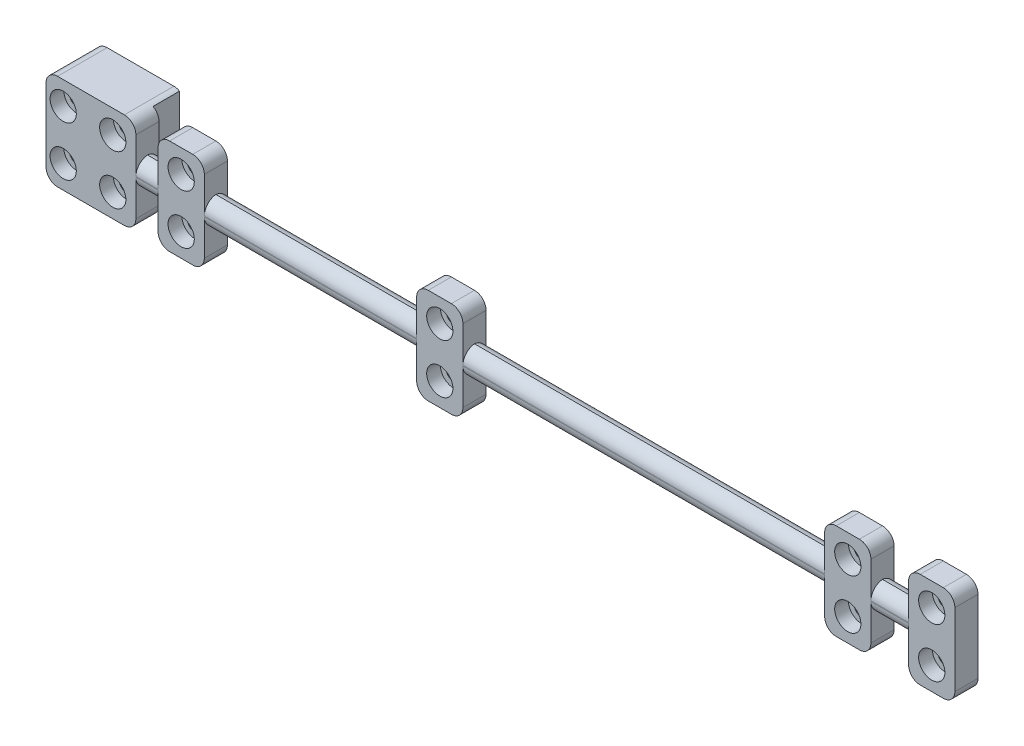
from build123d import *

# Parameters (mm, degrees)
SKETCH1_W                                      = 25.4
SKETCH1_H                                      = 29
BOSS_EXTRUDE1_DEPTH                            = 8
SKETCH2_W                                      = 275
SKETCH2_H                                      = 29
BOSS_EXTRUDE2_DEPTH                            = 7
CBORE_FOR_8_SOCKET_HEAD_CAP_SCREW1_D           = 4.4958
CBORE_FOR_8_SOCKET_HEAD_CAP_SCREW1_DEPTH       = 18.649325414
CBORE_FOR_8_SOCKET_HEAD_CAP_SCREW1_CBORE_D     = 7.9375
CBORE_FOR_8_SOCKET_HEAD_CAP_SCREW1_CBORE_DEPTH = 4.1656
CBORE_FOR_8_SOCKET_HEAD_CAP_SCREW1_TIP         = 1.350674586
SKETCH5_W                                      = 64.25
SKETCH5_H                                      = 10.5
SKETCH5_W_2                                    = 109.45
SKETCH5_W_3                                    = 11.4
SKETCH5_W_4                                    = 6.7
CUT_EXTRUDE1_DEPTH                             = 10
FILLET1_R                                      = 3.9
FILLET2_R                                      = 3.5


with BuildPart() as part:
    # Sketch1 → Boss-Extrude1 (new body)
    with BuildSketch(Plane.XY):
        Rectangle(SKETCH1_W, SKETCH1_H)
    extrude(amount=BOSS_EXTRUDE1_DEPTH)

    # Sketch2 → Boss-Extrude2 (add)
    with BuildSketch(Plane.XY.offset(8)):
        with Locations((124.8, 0)):
            Rectangle(SKETCH2_W, SKETCH2_H)
    extrude(amount=BOSS_EXTRUDE2_DEPTH)

    # CBORE for #8 Socket Head Cap Screw1
    with Locations(Plane(origin=(-7.5, 7.5, 15), x_dir=(1, 0, 0), z_dir=(0, 0, 1))):
        with Locations((0, 0), (15, 0), (15, -15), (0, -15), (35.7, 0), (35.7, -15), (113.95, 0), (113.95, -15), (237.4, 0), (237.4, -15), (262.8, 0), (262.8, -15)):
            CounterBoreHole(CBORE_FOR_8_SOCKET_HEAD_CAP_SCREW1_D / 2, CBORE_FOR_8_SOCKET_HEAD_CAP_SCREW1_CBORE_D / 2, CBORE_FOR_8_SOCKET_HEAD_CAP_SCREW1_CBORE_DEPTH, depth=CBORE_FOR_8_SOCKET_HEAD_CAP_SCREW1_DEPTH)
            with Locations((0, 0, -(CBORE_FOR_8_SOCKET_HEAD_CAP_SCREW1_DEPTH + CBORE_FOR_8_SOCKET_HEAD_CAP_SCREW1_TIP / 2))):  # 118° drill point
                Cone(0, CBORE_FOR_8_SOCKET_HEAD_CAP_SCREW1_D / 2, CBORE_FOR_8_SOCKET_HEAD_CAP_SCREW1_TIP, mode=Mode.SUBTRACT)

    # Sketch5 → Cut-Extrude1 (cut)
    with BuildSketch(Plane.XY.offset(15)):
        with Locations((67.325, 9.25)):
            Rectangle(SKETCH5_W, SKETCH5_H)
        with Locations((168.175, 9.25)):
            Rectangle(SKETCH5_W_2, SKETCH5_H)
        with Locations((242.6, 9.25)):
            Rectangle(SKETCH5_W_3, SKETCH5_H)
        with Locations((17.85, 9.25)):
            Rectangle(SKETCH5_W_4, SKETCH5_H)
    cut_extrude1 = extrude(amount=-CUT_EXTRUDE1_DEPTH, mode=Mode.SUBTRACT)

    # Mirror1: Cut-Extrude1 across plane
    add(cut_extrude1.mirror(Plane.ZX), mode=Mode.SUBTRACT)

    # Fillet1
    # the kernel refuses this fillet: 3.9 mm, written as the material it takes off along each edge
    with BuildSketch(Plane(origin=(222.9, 4, 15), x_dir=(0, -1, 0), z_dir=(-1, 0, 0)), Plane(origin=(222.9, -4, 8), x_dir=(0, 1, 0), z_dir=(-1, 0, 0))) as fillet1_piece_1:
        with BuildLine():
            CenterArc((FILLET1_R, -FILLET1_R), FILLET1_R, 90, 90)
            Line((0, -FILLET1_R), (0, 0))
            Line((0, 0), (FILLET1_R, 0))
        make_face()
    extrude(amount=109.45, mode=Mode.SUBTRACT)
    with BuildSketch(Plane(origin=(248.3, 4, 15), x_dir=(0, -1, 0), z_dir=(-1, 0, 0)), Plane(origin=(248.3, -4, 8), x_dir=(0, 1, 0), z_dir=(-1, 0, 0))) as fillet1_piece_2:
        with BuildLine():
            CenterArc((FILLET1_R, -FILLET1_R), FILLET1_R, 90, 90)
            Line((0, -FILLET1_R), (0, 0))
            Line((0, 0), (FILLET1_R, 0))
        make_face()
    extrude(amount=11.4, mode=Mode.SUBTRACT)
    with BuildSketch(Plane(origin=(248.3, 4, 8), x_dir=(0, -1, 0), z_dir=(-1, 0, 0)), Plane(origin=(248.3, -4, 15), x_dir=(0, 1, 0), z_dir=(-1, 0, 0))) as fillet1_piece_3:
        with BuildLine():
            CenterArc((FILLET1_R, FILLET1_R), FILLET1_R, 180, 90)
            Line((0, FILLET1_R), (0, 0))
            Line((0, 0), (FILLET1_R, 0))
        make_face()
    extrude(amount=11.4, mode=Mode.SUBTRACT)
    with BuildSketch(Plane(origin=(222.9, -4, 15), x_dir=(0, 1, 0), z_dir=(-1, 0, 0)), Plane(origin=(222.9, 4, 8), x_dir=(0, -1, 0), z_dir=(-1, 0, 0))) as fillet1_piece_4:
        with BuildLine():
            CenterArc((FILLET1_R, FILLET1_R), FILLET1_R, 180, 90)
            Line((0, FILLET1_R), (0, 0))
            Line((0, 0), (FILLET1_R, 0))
        make_face()
    extrude(amount=109.45, mode=Mode.SUBTRACT)
    with BuildSketch(Plane(origin=(99.45, 4, 8), x_dir=(0, -1, 0), z_dir=(-1, 0, 0)), Plane(origin=(99.45, -4, 15), x_dir=(0, 1, 0), z_dir=(-1, 0, 0))) as fillet1_piece_5:
        with BuildLine():
            CenterArc((FILLET1_R, FILLET1_R), FILLET1_R, 180, 90)
            Line((0, FILLET1_R), (0, 0))
            Line((0, 0), (FILLET1_R, 0))
        make_face()
    extrude(amount=64.25, mode=Mode.SUBTRACT)
    with BuildSketch(Plane(origin=(99.45, 4, 15), x_dir=(0, -1, 0), z_dir=(-1, 0, 0)), Plane(origin=(99.45, -4, 8), x_dir=(0, 1, 0), z_dir=(-1, 0, 0))) as fillet1_piece_6:
        with BuildLine():
            CenterArc((FILLET1_R, -FILLET1_R), FILLET1_R, 90, 90)
            Line((0, -FILLET1_R), (0, 0))
            Line((0, 0), (FILLET1_R, 0))
        make_face()
    extrude(amount=64.25, mode=Mode.SUBTRACT)
    with BuildSketch(Plane(origin=(21.2, -4, 8), x_dir=(0, 1, 0), z_dir=(-1, 0, 0)), Plane(origin=(21.2, 4, 15), x_dir=(0, -1, 0), z_dir=(-1, 0, 0))) as fillet1_piece_7:
        with BuildLine():
            CenterArc((FILLET1_R, -FILLET1_R), FILLET1_R, 90, 90)
            Line((0, -FILLET1_R), (0, 0))
            Line((0, 0), (FILLET1_R, 0))
        make_face()
    extrude(amount=6.7, mode=Mode.SUBTRACT)
    with BuildSketch(Plane(origin=(21.2, -4, 15), x_dir=(0, 1, 0), z_dir=(-1, 0, 0)), Plane(origin=(21.2, 4, 8), x_dir=(0, -1, 0), z_dir=(-1, 0, 0))) as fillet1_piece_8:
        with BuildLine():
            CenterArc((FILLET1_R, FILLET1_R), FILLET1_R, 180, 90)
            Line((0, FILLET1_R), (0, 0))
            Line((0, 0), (FILLET1_R, 0))
        make_face()
    extrude(amount=6.7, mode=Mode.SUBTRACT)

    # Fillet2
    fillet2_edges = [part.edges().sort_by_distance(p)[0] for p in [
        (262.3, -14.5, 11.5),
        (14.5, 14.5, 11.5),
        (21.2, 14.5, 11.5),
        (262.3, 14.5, 11.5),
        (236.9, 14.5, 11.5),
        (248.3, 14.5, 11.5),
        (113.45, 14.5, 11.5),
        (222.9, 14.5, 11.5),
        (35.2, 14.5, 11.5),
        (99.45, 14.5, 11.5),
        (14.5, -14.5, 11.5),
        (21.2, -14.5, 11.5),
        (236.9, -14.5, 11.5),
        (248.3, -14.5, 11.5),
        (113.45, -14.5, 11.5),
        (222.9, -14.5, 11.5),
        (35.2, -14.5, 11.5),
        (99.45, -14.5, 11.5),
        (-12.7, -14.5, 7.5),
        (-12.7, 14.5, 7.5),
    ]]
    fillet(fillet2_edges, radius=FILLET2_R)


solid = part.part
